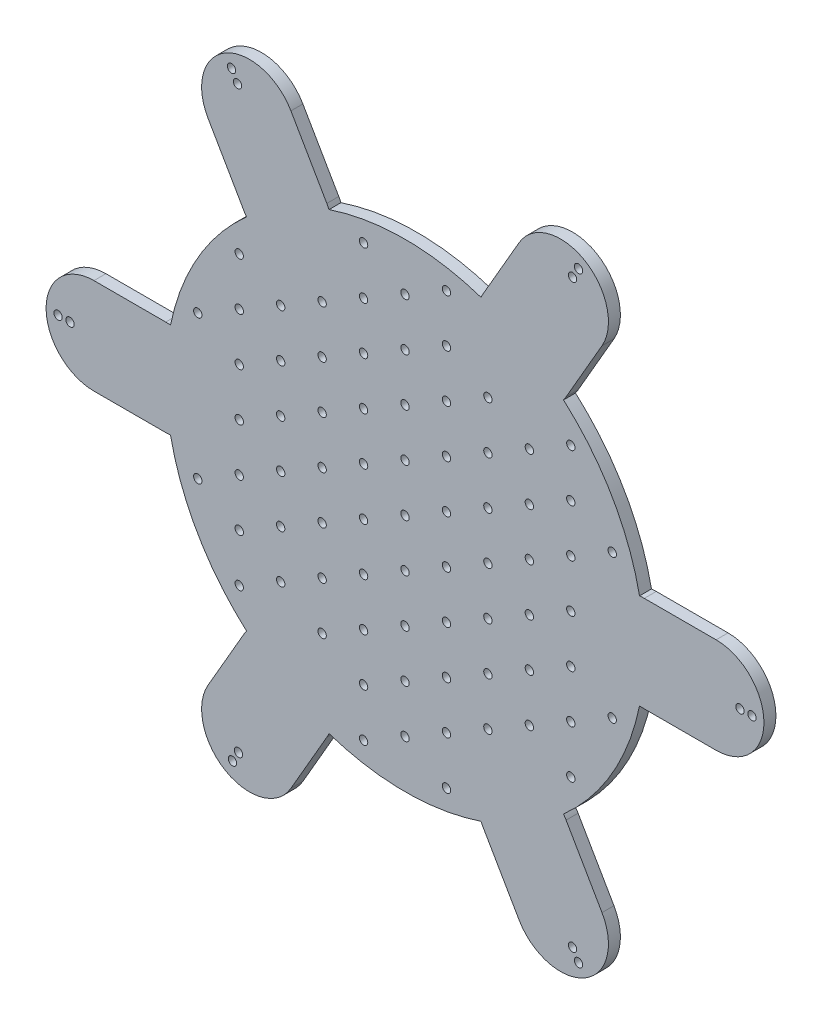
from build123d import *

# Parameters (mm, degrees)
SKETCH4_R               = 100
BOSS_EXTRUDE2_DEPTH     = 5
SKETCH5_R               = 1.75
CUT_EXTRUDE2_DEPTH      = 5
FILL_PATTERN2_OUTLINE_R = 1.75
FILL_PATTERN2_DEPTH     = 5
BOSS_EXTRUDE3_DEPTH     = 5
SKETCH10_R              = 1.75
CUT_EXTRUDE3_DEPTH      = 201.258163628


# Read off the part's stored shape, not the designer's step: Fill Pattern2
with BuildPart() as part:
    # Sketch4 → Boss-Extrude2 (new body)
    with BuildSketch(Plane.XY):
        Circle(SKETCH4_R)
    extrude(amount=BOSS_EXTRUDE2_DEPTH)

    # Sketch5 → Cut-Extrude2 (cut)
    with BuildSketch(Plane.XY.offset(5)):
        Circle(SKETCH5_R)
    extrude(amount=-CUT_EXTRUDE2_DEPTH, mode=Mode.SUBTRACT)

    # Fill Pattern2 outline → Fill Pattern2 (cut)
    with BuildSketch(Plane.XY):
        with Locations((17.320508076, 90)):
            Circle(FILL_PATTERN2_OUTLINE_R)
        with Locations((-86.602540378, -30)):
            Circle(FILL_PATTERN2_OUTLINE_R)
        with Locations((-69.282032303, -40)):
            Circle(FILL_PATTERN2_OUTLINE_R)
        with Locations((-51.961524227, -50)):
            Circle(FILL_PATTERN2_OUTLINE_R)
        with Locations((-34.641016151, -60)):
            Circle(FILL_PATTERN2_OUTLINE_R)
        with Locations((-69.282032303, -60)):
            Circle(FILL_PATTERN2_OUTLINE_R)
        with Locations((17.320508076, -90)):
            Circle(FILL_PATTERN2_OUTLINE_R)
        with Locations((0, -80)):
            Circle(FILL_PATTERN2_OUTLINE_R)
        with Locations((-17.320508076, -70)):
            Circle(FILL_PATTERN2_OUTLINE_R)
        with Locations((34.641016151, -80)):
            Circle(FILL_PATTERN2_OUTLINE_R)
        with Locations((17.320508076, -70)):
            Circle(FILL_PATTERN2_OUTLINE_R)
        with Locations((0, -60)):
            Circle(FILL_PATTERN2_OUTLINE_R)
        with Locations((-17.320508076, -50)):
            Circle(FILL_PATTERN2_OUTLINE_R)
        with Locations((-34.641016151, -40)):
            Circle(FILL_PATTERN2_OUTLINE_R)
        with Locations((-51.961524227, -30)):
            Circle(FILL_PATTERN2_OUTLINE_R)
        with Locations((-69.282032303, -20)):
            Circle(FILL_PATTERN2_OUTLINE_R)
        with Locations((-86.602540378, -10)):
            Circle(FILL_PATTERN2_OUTLINE_R)
        with Locations((-51.961524227, -70)):
            Circle(FILL_PATTERN2_OUTLINE_R)
        with Locations((-34.641016151, -80)):
            Circle(FILL_PATTERN2_OUTLINE_R)
        with Locations((-17.320508076, -90)):
            Circle(FILL_PATTERN2_OUTLINE_R)
        with Locations((34.641016151, 20)):
            Circle(FILL_PATTERN2_OUTLINE_R)
        with Locations((17.320508076, 30)):
            Circle(FILL_PATTERN2_OUTLINE_R)
        with Locations((0, 40)):
            Circle(FILL_PATTERN2_OUTLINE_R)
        with Locations((-17.320508076, 50)):
            Circle(FILL_PATTERN2_OUTLINE_R)
        with Locations((-34.641016151, 60)):
            Circle(FILL_PATTERN2_OUTLINE_R)
        with Locations((-51.961524227, 70)):
            Circle(FILL_PATTERN2_OUTLINE_R)
        with Locations((86.602540378, 10)):
            Circle(FILL_PATTERN2_OUTLINE_R)
        with Locations((69.282032303, 20)):
            Circle(FILL_PATTERN2_OUTLINE_R)
        with Locations((0, 20)):
            Circle(FILL_PATTERN2_OUTLINE_R)
        with Locations((-17.320508076, 30)):
            Circle(FILL_PATTERN2_OUTLINE_R)
        with Locations((-34.641016151, 40)):
            Circle(FILL_PATTERN2_OUTLINE_R)
        with Locations((-51.961524227, 50)):
            Circle(FILL_PATTERN2_OUTLINE_R)
        with Locations((51.961524227, 10)):
            Circle(FILL_PATTERN2_OUTLINE_R)
        with Locations((69.282032303, 0)):
            Circle(FILL_PATTERN2_OUTLINE_R)
        with Locations((86.602540378, -10)):
            Circle(FILL_PATTERN2_OUTLINE_R)
        with Locations((-69.282032303, 60)):
            Circle(FILL_PATTERN2_OUTLINE_R)
        with Locations((51.961524227, 50)):
            Circle(FILL_PATTERN2_OUTLINE_R)
        with Locations((34.641016151, 60)):
            Circle(FILL_PATTERN2_OUTLINE_R)
        with Locations((17.320508076, 70)):
            Circle(FILL_PATTERN2_OUTLINE_R)
        with Locations((0, 80)):
            Circle(FILL_PATTERN2_OUTLINE_R)
        with Locations((34.641016151, 80)):
            Circle(FILL_PATTERN2_OUTLINE_R)
        with Locations((51.961524227, 70)):
            Circle(FILL_PATTERN2_OUTLINE_R)
        with Locations((69.282032303, 60)):
            Circle(FILL_PATTERN2_OUTLINE_R)
        with Locations((-17.320508076, 90)):
            Circle(FILL_PATTERN2_OUTLINE_R)
        with Locations((51.961524227, 30)):
            Circle(FILL_PATTERN2_OUTLINE_R)
        with Locations((34.641016151, 40)):
            Circle(FILL_PATTERN2_OUTLINE_R)
        with Locations((17.320508076, 50)):
            Circle(FILL_PATTERN2_OUTLINE_R)
        with Locations((0, 60)):
            Circle(FILL_PATTERN2_OUTLINE_R)
        with Locations((-17.320508076, 70)):
            Circle(FILL_PATTERN2_OUTLINE_R)
        with Locations((-34.641016151, 80)):
            Circle(FILL_PATTERN2_OUTLINE_R)
        with Locations((86.602540378, 30)):
            Circle(FILL_PATTERN2_OUTLINE_R)
        with Locations((69.282032303, 40)):
            Circle(FILL_PATTERN2_OUTLINE_R)
        with Locations((34.641016151, -40)):
            Circle(FILL_PATTERN2_OUTLINE_R)
        with Locations((51.961524227, -50)):
            Circle(FILL_PATTERN2_OUTLINE_R)
        with Locations((69.282032303, -60)):
            Circle(FILL_PATTERN2_OUTLINE_R)
        with Locations((-86.602540378, 10)):
            Circle(FILL_PATTERN2_OUTLINE_R)
        with Locations((17.320508076, -30)):
            Circle(FILL_PATTERN2_OUTLINE_R)
        with Locations((0, -20)):
            Circle(FILL_PATTERN2_OUTLINE_R)
        with Locations((-17.320508076, -10)):
            Circle(FILL_PATTERN2_OUTLINE_R)
        with Locations((-34.641016151, 0)):
            Circle(FILL_PATTERN2_OUTLINE_R)
        with Locations((-69.282032303, 0)):
            Circle(FILL_PATTERN2_OUTLINE_R)
        with Locations((-51.961524227, -10)):
            Circle(FILL_PATTERN2_OUTLINE_R)
        with Locations((-34.641016151, -20)):
            Circle(FILL_PATTERN2_OUTLINE_R)
        with Locations((-17.320508076, -30)):
            Circle(FILL_PATTERN2_OUTLINE_R)
        with Locations((0, -40)):
            Circle(FILL_PATTERN2_OUTLINE_R)
        with Locations((17.320508076, -50)):
            Circle(FILL_PATTERN2_OUTLINE_R)
        with Locations((34.641016151, -60)):
            Circle(FILL_PATTERN2_OUTLINE_R)
        with Locations((51.961524227, -70)):
            Circle(FILL_PATTERN2_OUTLINE_R)
        with Locations((86.602540378, -30)):
            Circle(FILL_PATTERN2_OUTLINE_R)
        with Locations((-69.282032303, 40)):
            Circle(FILL_PATTERN2_OUTLINE_R)
        with Locations((-51.961524227, 30)):
            Circle(FILL_PATTERN2_OUTLINE_R)
        with Locations((-34.641016151, 20)):
            Circle(FILL_PATTERN2_OUTLINE_R)
        with Locations((69.282032303, -20)):
            Circle(FILL_PATTERN2_OUTLINE_R)
        with Locations((51.961524227, -10)):
            Circle(FILL_PATTERN2_OUTLINE_R)
        with Locations((34.641016151, 0)):
            Circle(FILL_PATTERN2_OUTLINE_R)
        with Locations((17.320508076, 10)):
            Circle(FILL_PATTERN2_OUTLINE_R)
        with Locations((69.282032303, -40)):
            Circle(FILL_PATTERN2_OUTLINE_R)
        with Locations((-86.602540378, 30)):
            Circle(FILL_PATTERN2_OUTLINE_R)
        with Locations((-69.282032303, 20)):
            Circle(FILL_PATTERN2_OUTLINE_R)
        with Locations((-51.961524227, 10)):
            Circle(FILL_PATTERN2_OUTLINE_R)
        with Locations((51.961524227, -30)):
            Circle(FILL_PATTERN2_OUTLINE_R)
        with Locations((34.641016151, -20)):
            Circle(FILL_PATTERN2_OUTLINE_R)
        with Locations((17.320508076, -10)):
            Circle(FILL_PATTERN2_OUTLINE_R)
        with Locations((-17.320508076, 10)):
            Circle(FILL_PATTERN2_OUTLINE_R)
    extrude(amount=FILL_PATTERN2_DEPTH, mode=Mode.SUBTRACT)

    # Sketch9 → Boss-Extrude3 (add)
    with BuildSketch(Plane.XY.offset(5)):
        with BuildLine():
            Line((67.320508076, -76.602540378), (82.320508076, -102.583302492))
            ThreePointArc((82.320508076, -102.583302492), (75, -129.903810568), (47.679491924, -122.583302492))
            Line((47.679491924, -122.583302492), (32.679491924, -96.602540378))
            ThreePointArc((32.679491924, -96.602540378), (40, -69.282032303), (67.320508076, -76.602540378))
        make_face()
        with BuildLine():
            Line((-67.320508076, -76.602540378), (-82.320508076, -102.583302492))
            ThreePointArc((-82.320508076, -102.583302492), (-75, -129.903810568), (-47.679491924, -122.583302492))
            Line((-47.679491924, -122.583302492), (-32.679491924, -96.602540378))
            ThreePointArc((-32.679491924, -96.602540378), (-40, -69.282032303), (-67.320508076, -76.602540378))
        make_face()
        with BuildLine():
            Line((-100, -20), (-130, -20))
            ThreePointArc((-130, -20), (-150, 0), (-130, 20))
            Line((-130, 20), (-100, 20))
            ThreePointArc((-100, 20), (-80, 0), (-100, -20))
        make_face()
        with BuildLine():
            Line((67.320508076, 76.602540378), (82.320508076, 102.583302492))
            ThreePointArc((82.320508076, 102.583302492), (75, 129.903810568), (47.679491924, 122.583302492))
            Line((47.679491924, 122.583302492), (32.679491924, 96.602540378))
            ThreePointArc((32.679491924, 96.602540378), (40, 69.282032303), (67.320508076, 76.602540378))
        make_face()
        with BuildLine():
            Line((-67.320508076, 76.602540378), (-82.320508076, 102.583302492))
            ThreePointArc((-82.320508076, 102.583302492), (-75, 129.903810568), (-47.679491924, 122.583302492))
            Line((-47.679491924, 122.583302492), (-32.679491924, 96.602540378))
            ThreePointArc((-32.679491924, 96.602540378), (-40, 69.282032303), (-67.320508076, 76.602540378))
        make_face()
        with BuildLine():
            Line((100, 20), (130, 20))
            ThreePointArc((130, 20), (150, 0), (130, -20))
            Line((130, -20), (100, -20))
            ThreePointArc((100, -20), (80, 0), (100, 20))
        make_face()
    extrude(amount=-BOSS_EXTRUDE3_DEPTH)

    # Sketch10 → Cut-Extrude3 (cut, through all)
    with BuildSketch(Plane(origin=(0, 0, 0), x_dir=(-1, 0, 0), z_dir=(0, 0, -1))):
        with Locations((145, 0)):
            Circle(SKETCH10_R)
        with Locations((140, 0)):
            Circle(SKETCH10_R)
        with Locations((72.5, 125.573683549)):
            Circle(SKETCH10_R)
        with Locations((70, 121.24355653)):
            Circle(SKETCH10_R)
        with Locations(Location((-140, 0, 0), (0, 0, 180))):
            Circle(SKETCH10_R)
        with Locations(Location((-145, 0, 0), (0, 0, 180))):
            Circle(SKETCH10_R)
        with Locations((72.113248654, -124.903810568)):
            Circle(SKETCH10_R)
        with Locations((69.613248654, -120.573683549)):
            Circle(SKETCH10_R)
        with Locations((-72.5, 125.573683549)):
            Circle(SKETCH10_R)
        with Locations((-70, 121.24355653)):
            Circle(SKETCH10_R)
        with Locations((-72.5, -125.573683549)):
            Circle(SKETCH10_R)
        with Locations((-70, -121.24355653)):
            Circle(SKETCH10_R)
    extrude(amount=-CUT_EXTRUDE3_DEPTH, mode=Mode.SUBTRACT)


solid = part.part
